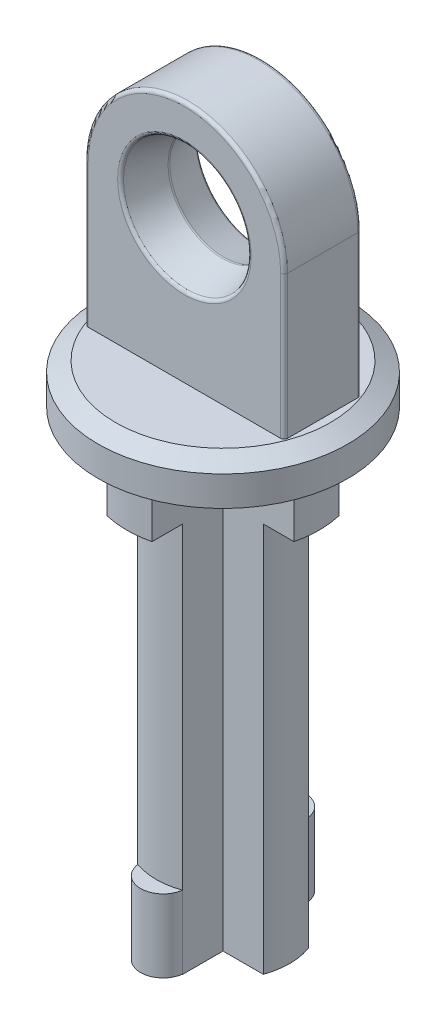
from build123d import *

# Parameters (mm, degrees)
CROQUIS1_R                 = 5.5
SALIENTE_EXTRUIR1_DEPTH    = 26.5
CROQUIS2_R                 = 7.2
SALIENTE_EXTRUIR2_DEPTH    = 2.3
CROQUIS3_W                 = 11.5
CROQUIS3_H                 = 4.45
SALIENTE_EXTRUIR3_DEPTH    = 14
CORTAR_EXTRUIR1_DEPTH      = 13.37
CROQUIS6_R                 = 4
CORTAR_EXTRUIR2_DEPTH      = 26.5
CROQUIS7_R                 = 2.8
CORTAR_EXTRUIR3_DEPTH      = 26.37
CHAFL_N1_SIZE              = 0.9
CHAFL_N1_SIZE2             = 3.358845727
CHAFL_N2_SIZE              = 3.358845727
CHAFL_N2_SIZE_2            = 0.9
REDONDEO1_R                = 0.2
REDONDEO2_R                = 0.2
CROQUIS11_W                = 4
CROQUIS11_H                = 22.3
CORTAR_EXTRUIR4_DEPTH      = 48.550085436
CORTAR_EXTRUIR5_DEPTH      = 8.4
REDONDEO3_R                = 0.2
CROQUIS14_W                = 14.4
CROQUIS14_H                = 26.5
CORTAR_EXTRUIR6_DEPTH      = 28.4
SALIENTE_EXTRUIR4_DEPTH    = 3.4
SALIENTE_EXTRUIR5_DEPTH    = 22.5
SALIENTE_EXTRUIR6_DEPTH    = 4.2
CHAFL_N3_SIZE              = 1
CHAFL_N3_SIZE2             = 0.577350269
S_LIDO_MOVER_COPIAR1_ANGLE = 90


with BuildPart() as part:
    # Croquis1 → Saliente-Extruir1 (new body)
    with BuildSketch(Plane(origin=(0, 0, 0), x_dir=(1, 0, 0), z_dir=(0, 1, 0))):
        with Locations(Location((0, 0, 0), (0, 0, 270))):
            Circle(CROQUIS1_R)
    extrude(amount=SALIENTE_EXTRUIR1_DEPTH)

    # Croquis2 → Saliente-Extruir2 (add)
    with BuildSketch(Plane(origin=(0, 26.5, 0), x_dir=(1, 0, 0), z_dir=(0, 1, 0))):
        with Locations(Location((0, 0, 0), (0, 0, 270))):
            Circle(CROQUIS2_R)
    extrude(amount=SALIENTE_EXTRUIR2_DEPTH)

    # Croquis3 → Saliente-Extruir3 (add)
    with BuildSketch(Plane(origin=(0, 28.8, 0), x_dir=(1, 0, 0), z_dir=(0, 1, 0))):
        Rectangle(CROQUIS3_W, CROQUIS3_H)
    extrude(amount=SALIENTE_EXTRUIR3_DEPTH)

    # Croquis4 → Cortar-Extruir1 (cut)
    with BuildSketch(Plane.XY.offset(2.225)):
        with BuildLine():
            Line((5.75, 42.8), (0, 42.8))
            ThreePointArc((0, 42.8), (4.065863992, 41.115863992), (5.75, 37.05))
            Line((5.75, 37.05), (5.75, 42.8))
        make_face()
        with BuildLine():
            Line((0, 42.8), (-5.75, 42.8))
            Line((-5.75, 42.8), (-5.75, 37.05))
            ThreePointArc((-5.75, 37.05), (-4.065863992, 41.115863992), (0, 42.8))
        make_face()
    extrude(amount=-CORTAR_EXTRUIR1_DEPTH, mode=Mode.SUBTRACT)

    # Croquis6 → Cortar-Extruir2 (cut)
    with BuildSketch(Plane.XZ):
        with Locations(Location((0, 0, 0), (0, 0, 270))):
            Circle(CROQUIS6_R)
    extrude(amount=-CORTAR_EXTRUIR2_DEPTH, mode=Mode.SUBTRACT)

    # Croquis7 → Cortar-Extruir3 (cut)
    with BuildSketch(Plane.XY.offset(2.225)):
        with Locations((0, 37.05)):
            Circle(CROQUIS7_R)
    extrude(amount=-CORTAR_EXTRUIR3_DEPTH, mode=Mode.SUBTRACT)

    # Chaflán1
    chafl_n1_edges = [part.edges().sort_by_distance(p)[0] for p in [
        (-2.8, 37.05, 2.225),
    ]]
    chafl_n1_side = [part.faces().sort_by_distance(p)[0] for p in [
        (0, 28.981176709, 2.225),
    ]]
    chamfer(chafl_n1_edges, length=CHAFL_N1_SIZE, length2=CHAFL_N1_SIZE2, reference=chafl_n1_side[0])

    # Chaflán2
    # the kernel refuses this chamfer: 3.358845727, 0.9 mm, written as the material it takes off along each edge
    with BuildSketch(Plane(origin=(0, 37.05, -2.225), x_dir=(1, 0, 0), z_dir=(0, -1, 0))) as chafl_n2_piece_1:
        Polygon((2.8, CHAFL_N2_SIZE), (2.8 + CHAFL_N2_SIZE_2, 0), (2.8, 0), align=None)
    revolve(axis=Axis((0, 37.05, -2.225), (0, 0, 1)), mode=Mode.SUBTRACT)

    # Redondeo1
    redondeo1_edges = [part.edges().sort_by_distance(p)[0] for p in [
        (-5.75, 32.925, 2.225),
        (-5.75, 32.925, -2.225),
        (0, 42.8, 2.225),
        (0, 42.8, -2.225),
        (5.75, 32.925, -2.225),
        (5.75, 32.925, 2.225),
    ]]
    fillet(redondeo1_edges, radius=REDONDEO1_R)

    # Redondeo2
    redondeo2_edges = [part.edges().sort_by_distance(p)[0] for p in [
        (-3.7, 37.05, 2.225),
        (-3.7, 37.05, -2.225),
        (-3.103813047, 37.05, 0),
    ]]
    fillet(redondeo2_edges, radius=REDONDEO2_R)

    # Croquis11 → Cortar-Extruir4 (cut, through all)
    with BuildSketch(Plane.XY.offset(12.225)):
        with Locations((0, 15.35)):
            Rectangle(CROQUIS11_W, CROQUIS11_H)
    extrude(amount=-CORTAR_EXTRUIR4_DEPTH, mode=Mode.SUBTRACT)

    # Croquis13 → Cortar-Extruir5 (cut)
    with BuildSketch(Plane.XZ):
        with BuildLine():
            Line((-2, -4.19791615), (4.520060123, 1.091584394))
            ThreePointArc((4.520060123, 1.091584394), (3.611110666, 2.929569892), (2, 4.19791615))
            Line((2, 4.19791615), (-4.520060123, -1.091584394))
            ThreePointArc((-4.520060123, -1.091584394), (-3.611110666, -2.929569892), (-2, -4.19791615))
        make_face()
    extrude(amount=-CORTAR_EXTRUIR5_DEPTH, mode=Mode.SUBTRACT)

    # Redondeo3
    redondeo3_edges = [part.edges().sort_by_distance(p)[0] for p in [
        (-2, 4.2, -4.660695766),
        (-2, 4.2, 4.293788499),
        (-2, 26.5, -4.293788499),
        (-2, 26.5, 4.293788499),
        (2, 26.5, 4.293788499),
        (2, 26.5, -4.293788499),
        (2, 4.2, -4.293788499),
        (2, 4.2, 4.660695766),
    ]]
    fillet(redondeo3_edges, radius=REDONDEO3_R)

    # Croquis14 → Cortar-Extruir6 (cut)
    with BuildSketch(Plane(origin=(15.75, 0, 0), x_dir=(0, 0, -1), z_dir=(1, 0, 0))):
        with Locations((0, 13.25)):
            Rectangle(CROQUIS14_W, CROQUIS14_H)
    extrude(amount=-CORTAR_EXTRUIR6_DEPTH, mode=Mode.SUBTRACT)

    # Chaflán3
    chafl_n3_edges = [part.edges().sort_by_distance(p)[0] for p in [
        (0, 28.8, -7.2),
    ]]
    chafl_n3_side = [part.faces().sort_by_distance(p)[0] for p in [
        (-5.953646753, 28.8, 0),
    ]]
    chamfer(chafl_n3_edges, length=CHAFL_N3_SIZE, length2=CHAFL_N3_SIZE2, reference=chafl_n3_side[0])


with BuildPart() as body_2:
    # Croquis15 → Saliente-Extruir4 (new body)
    with BuildSketch(Plane.XZ.offset(-26.5)):
        with BuildLine():
            Line((-1.3, 5.395600059), (-1.3, 1.3))
            Line((-1.3, 1.3), (-5.395600059, 1.3))
            ThreePointArc((-5.395600059, 1.3), (-5.55, 0), (-5.395600059, -1.3))
            Line((-5.395600059, -1.3), (-1.3, -1.3))
            Line((-1.3, -1.3), (-1.3, -5.395600059))
            ThreePointArc((-1.3, -5.395600059), (0, -5.55), (1.3, -5.395600059))
            Line((1.3, -5.395600059), (1.3, -1.3))
            Line((1.3, -1.3), (5.395600059, -1.3))
            ThreePointArc((5.395600059, -1.3), (5.55, 0), (5.395600059, 1.3))
            Line((5.395600059, 1.3), (1.3, 1.3))
            Line((1.3, 1.3), (1.3, 5.395600059))
            ThreePointArc((1.3, 5.395600059), (0, 5.55), (-1.3, 5.395600059))
        make_face()
    extrude(amount=SALIENTE_EXTRUIR4_DEPTH)


with BuildPart() as body_3:
    # Croquis16 → Saliente-Extruir5 (new body)
    with BuildSketch(Plane.XZ.offset(-23.1)):
        with BuildLine():
            Line((-3.623879137, 1.3), (-1.3, 1.3))
            Line((-1.3, 1.3), (-1.3, 3.623879137))
            ThreePointArc((-1.3, 3.623879137), (0, 3.85), (1.3, 3.623879137))
            Line((1.3, 3.623879137), (1.3, 1.3))
            Line((1.3, 1.3), (3.623879137, 1.3))
            ThreePointArc((3.623879137, 1.3), (3.85, 0), (3.623879137, -1.3))
            Line((3.623879137, -1.3), (1.3, -1.3))
            Line((1.3, -1.3), (1.3, -3.623879137))
            ThreePointArc((1.3, -3.623879137), (0, -3.85), (-1.3, -3.623879137))
            Line((-1.3, -3.623879137), (-1.3, -1.3))
            Line((-1.3, -1.3), (-3.623879137, -1.3))
            ThreePointArc((-3.623879137, -1.3), (-3.85, 0), (-3.623879137, 1.3))
        make_face()
    extrude(amount=SALIENTE_EXTRUIR5_DEPTH)


with BuildPart() as body_4:
    # Croquis17 → Saliente-Extruir6 (new body)
    with BuildSketch(Plane.XZ.offset(-0.6)):
        with BuildLine():
            Line((-3.45, 1.3), (3.45, 1.3))
            ThreePointArc((3.45, 1.3), (4.75, 0), (3.45, -1.3))
            Line((3.45, -1.3), (-3.45, -1.3))
            ThreePointArc((-3.45, -1.3), (-4.75, 0), (-3.45, 1.3))
        make_face()
    extrude(amount=-SALIENTE_EXTRUIR6_DEPTH)


with BuildPart() as body_3_1:
    add(body_3.part)

    # Combinar1: union body 4
    add(body_4.part)


with BuildPart() as body_2_1:
    add(body_2.part)

    # Combinar2: union body 3
    add(body_3_1.part)


with BuildPart() as body_2_2:
    # Sólido-Mover/Copiar1: moved
    add(body_2_1.part.rotate(Axis((0, 0, 0), (0, 1, 0)), S_LIDO_MOVER_COPIAR1_ANGLE))

    # Combinar3: union part
    add(part.part)


solid = body_2_2.part
